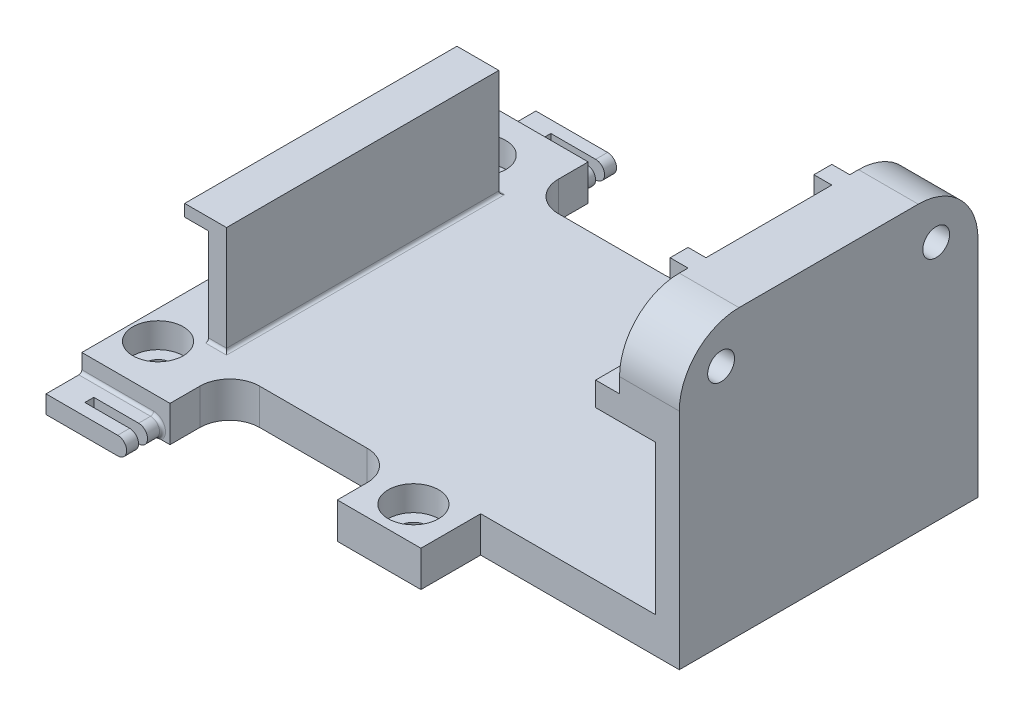
from build123d import *

# Parameters (mm, degrees)
EXTRUDE_BASE_DEPTH              = 35
SKETCH2_R                       = 2.2
SKETCH2_R_2                     = 2.2479
CUT_BOLT_HOLES_DEPTH            = 10
CUT_BOLT_HEAD_INSETS_DEPTH      = 13
CUT_BOLT_HEAD_INSETS_DEPTH_BACK = 4.2
SKETCH3_R                       = 4.215
SKETCH4_W                       = 40
SKETCH4_H                       = 3
CUT_TOP_CLEARANCE_SLOT_DEPTH    = 45
FILLET_CLEARANCE_SLOT_PT_1_R    = 3
FILLET_CLEARANCE_SLOT_PT_2_R    = 3
BOSS_EXTRUDE1_DEPTH             = 6
BOSS_EXTRUDE2_START             = 6
BOSS_EXTRUDE2_DEPTH             = 6
SKETCH9_R                       = 2.2479
BOSS_EXTRUDE3_DEPTH             = 10
FILLET1_R                       = 0.5
CUT_EXTRUDE1_REACH              = 103.769
SKETCH10_W                      = 7
SKETCH10_H                      = 12.215570114
FILLET2_R                       = 0.5
CUT_EXTRUDE2_START              = -35
SKETCH11_W                      = 33.244666378
SKETCH11_H                      = 11
CUT_EXTRUDE2_DEPTH              = 35
SKETCH13_W                      = 28
SKETCH13_H                      = 10.000570114
CUT_EXTRUDE5_DEPTH              = 6
FILLET3_R                       = 5
SKETCH14_W                      = 3
SKETCH14_H                      = 12.5
BOSS_EXTRUDE4_DEPTH             = 3
SKETCH15_W                      = 9
SKETCH15_H                      = 1.5
CUT_EXTRUDE6_DEPTH              = 10
CUT_EXTRUDE7_DEPTH              = 6


# Some blends are built 0.0001 mm under size
with BuildPart() as part:
    # Sketch1 → Extrude-Base (new, symmetric)
    with BuildSketch(Plane.XY):
        Polygon((-14, 0), (0, 0), (0, -35), (-90, -35), (-90, -29), (-81, -29), (-81, -13), (-85, -13), (-85, -11), (-78, -11), (-78, -29), (-4, -29), (-4, -4), (-14, -4), align=None)
    extrude(amount=EXTRUDE_BASE_DEPTH, both=True)

    # Sketch2 → Cut-Bolt Holes (cut)
    with BuildSketch(Plane(origin=(0, -29, 0), x_dir=(1, 0, 0), z_dir=(0, 1, 0))):
        with Locations(Location((-12, -10, 0), (0, 0, 270))):
            Circle(SKETCH2_R)
        with Locations(Location((-12, 10, 0), (0, 0, 180))):
            Circle(SKETCH2_R)
        with Locations(Location((-40.244666378, 29.250570114, 0), (0, 0, 270))):
            Circle(SKETCH2_R_2)
        with Locations(Location((-40.244666378, -29.249429886, 0), (0, 0, 270))):
            Circle(SKETCH2_R_2)
        with Locations(Location((-85.244666378, 27.000570114, 0), (0, 0, 270))):
            Circle(SKETCH2_R)
        with Locations(Location((-85.244666378, -26.999429886, 0), (0, 0, 270))):
            Circle(SKETCH2_R)
    extrude(amount=-CUT_BOLT_HOLES_DEPTH, mode=Mode.SUBTRACT)

    # Sketch3 → Cut-Bolt Head Insets (cut, two sides: drawn at the far end of the back side and taken through both)
    with BuildSketch(Plane(origin=(0, -29, 0), x_dir=(1, 0, 0), z_dir=(0, 1, 0)).offset(-CUT_BOLT_HEAD_INSETS_DEPTH_BACK)):
        with Locations((-12, -10)):
            Circle(SKETCH3_R)
        with Locations((-40.244666378, -29.249429886)):
            Circle(SKETCH3_R)
        with Locations((-85.244666378, -26.999429886)):
            Circle(SKETCH3_R)
        with Locations((-85.244666378, 27.000570114)):
            Circle(SKETCH3_R)
        with Locations(Location((-12, 10, 0), (0, 0, 90))):
            Circle(SKETCH3_R)
        with Locations(Location((-40.244666378, 29.249429886, 0), (0, 0, 90))):
            Circle(SKETCH3_R)
    extrude(amount=CUT_BOLT_HEAD_INSETS_DEPTH + CUT_BOLT_HEAD_INSETS_DEPTH_BACK, mode=Mode.SUBTRACT)

    # Sketch4 → Cut-Top Clearance Slot (cut)
    with BuildSketch(Plane.ZY.offset(90)):
        with Locations((0, -33.5)):
            Rectangle(SKETCH4_W, SKETCH4_H)
    extrude(amount=-CUT_TOP_CLEARANCE_SLOT_DEPTH, mode=Mode.SUBTRACT)

    # Fillet-Clearance Slot Pt 1
    fillet_clearance_slot_pt_1_edges = [part.edges().sort_by_distance(p)[0] for p in [
        (-67.5, -32, 20),
        (-67.5, -32, -20),
    ]]
    fillet(fillet_clearance_slot_pt_1_edges, radius=FILLET_CLEARANCE_SLOT_PT_1_R - 0.0001)  # a hair under: the kernel refuses the full size

    # Fillet-Clearance Slot Pt 2
    # the kernel refuses this fillet: 3 mm, written as the material it takes off along each edge
    with BuildSketch(Plane(origin=(-95.490486718, -35, 20), x_dir=(0, 0, 1), z_dir=(1, 0, 0))) as fillet_clearance_slot_pt_2_piece_1:
        with BuildLine():
            CenterArc((2.196194687, -3), FILLET_CLEARANCE_SLOT_PT_2_R, 90, 60.000551337)
            Line((-0.401895958, -1.500025), (-0.661705022, -1.3500275))
            ThreePointArc((-0.661705022, -1.3500275), (-0.3, -0.0001), (-0.3, 0))
            Line((-0.3, 0), (0, 0.3))
            Line((0, 0.3), (2.196194687, 0.3))
            Line((2.196194687, 0.3), (2.196194687, 0))
        make_face()
    extrude(amount=50.490486718, mode=Mode.SUBTRACT)
    with BuildSketch(Plane(origin=(-95.490486718, -35, -20), x_dir=(0, 0.9659313848535164, 0.2587982993664522), z_dir=(1, 0, 0))) as fillet_clearance_slot_pt_2_piece_2:
        with BuildLine():
            CenterArc((2.329422704, -2.897768274), FILLET_CLEARANCE_SLOT_PT_2_R, 105.000679234, 60.000551337)
            Line((-0.56837145, -2.121373376), (-0.858150866, -2.043733886))
            Line((-0.858150866, -2.043733886), (-0.289779415, 0.07763949))
            Line((-0.289779415, 0.07763949), (0.07763949, 0.289779415))
            ThreePointArc((0.07763949, 0.289779415), (0.077736083, 0.289753536), (1.475282068, 0.289776827))
            Line((1.475282068, 0.289776827), (1.552931216, 0))
        make_face()
    extrude(amount=50.490486718, mode=Mode.SUBTRACT)

    # Sketch5 → Boss-Extrude1 (add)
    with BuildSketch(Plane.XY.offset(35)):
        with BuildLine():
            Line((-78, -35), (-90, -35))
            Line((-90, -35), (-90, -32))
            Line((-90, -32), (-78, -32))
            ThreePointArc((-78, -32), (-76.5, -33.5), (-78, -35))
        make_face()
    extrude(amount=BOSS_EXTRUDE1_DEPTH)

    # Sketch7 → Boss-Extrude2 (add)
    with BuildSketch(Plane(origin=(0, 0, -35), x_dir=(-1, 0, 0), z_dir=(0, 0, -1)).offset(BOSS_EXTRUDE2_START)):
        with BuildLine():
            Line((78, -32), (90, -32))
            Line((90, -32), (90, -35))
            Line((90, -35), (78, -35))
            ThreePointArc((78, -35), (76.5, -33.5), (78, -32))
        make_face()
    extrude(amount=-BOSS_EXTRUDE2_DEPTH)

    # Sketch9 → Boss-Extrude3 (add)
    with BuildSketch(Plane(origin=(0, 0, 0), x_dir=(0, 0, -1), z_dir=(1, 0, 0))):
        with BuildLine():
            Line((25.000570114, 0), (-24.999429886, 0))
            Line((-24.999429886, 0), (-24.999429886, 2.5))
            ThreePointArc((-24.999429886, 2.5), (-22.070497698, 9.571067812), (-14.999429886, 12.5))
            Line((-14.999429886, 12.5), (15.000570114, 12.5))
            ThreePointArc((15.000570114, 12.5), (22.071637926, 9.571067812), (25.000570114, 2.5))
            Line((25.000570114, 2.5), (25.000570114, 0))
        make_face()
        with Locations(Location((-17.999429886, 5.5, 0), (0, 0, 90))):
            Circle(SKETCH9_R, mode=Mode.SUBTRACT)
        with Locations(Location((18.000570114, 5.5, 0), (0, 0, 90))):
            Circle(SKETCH9_R, mode=Mode.SUBTRACT)
    extrude(amount=-BOSS_EXTRUDE3_DEPTH)

    # Fillet1
    # the kernel refuses this fillet: 0.5 mm, written as the material it adds along each edge
    with BuildSketch(Plane(origin=(-78, -33.5, 35), x_dir=(0, 1, 0), z_dir=(-1, 0, 0))) as fillet1_piece_1_section:
        with BuildLine():
            CenterArc((1.5 + FILLET1_R, -FILLET1_R), FILLET1_R, 90, 90)
            Line((1.5, -FILLET1_R), (1.5, 0))
            Line((1.5, 0), (1.5 + FILLET1_R, 0))
        make_face()
    fillet1_piece_1 = revolve(axis=Axis((-78, -33.5, 35), (0, 0, -1)), revolution_arc=227.8232683, mode=Mode.PRIVATE)
    fillet1_piece_1 = split(fillet1_piece_1, bisect_by=Plane(origin=(-77.658393022, -35, 35.082006822), z_dir=(0, 1, 0)), keep=Keep.TOP, mode=Mode.PRIVATE)
    add(fillet1_piece_1)
    with BuildSketch(Plane(origin=(-90, -32, 35), x_dir=(0, 1, 0), z_dir=(1, 0, 0))) as fillet1_piece_2:
        with BuildLine():
            CenterArc((FILLET1_R, FILLET1_R), FILLET1_R, 180, 90)
            Line((0, FILLET1_R), (0, 0))
            Line((0, 0), (FILLET1_R, 0))
        make_face()
    extrude(amount=12)
    with BuildSketch(Plane(origin=(-78, -33.5, -35), x_dir=(-0.741077326598375, -0.6714196869334451, 0), z_dir=(-0.6714196869334451, 0.741077326598375, 0))) as fillet1_piece_3_section:
        with BuildLine():
            CenterArc((1.5 + FILLET1_R, -FILLET1_R), FILLET1_R, 90, 90)
            Line((1.5, -FILLET1_R), (1.5, 0))
            Line((1.5, 0), (1.5 + FILLET1_R, 0))
        make_face()
    fillet1_piece_3 = revolve(axis=Axis((-78, -33.5, -35), (0, 0, 1)), revolution_arc=227.8232683, mode=Mode.PRIVATE)
    fillet1_piece_3 = split(fillet1_piece_3, bisect_by=Plane(origin=(-76.494034021, -35, -35.2500003), z_dir=(0, 1, 0)), keep=Keep.TOP, mode=Mode.PRIVATE)
    add(fillet1_piece_3)
    with BuildSketch(Plane(origin=(-78, -32, -35), x_dir=(0, 0, -1), z_dir=(-1, 0, 0))) as fillet1_piece_4:
        with BuildLine():
            CenterArc((FILLET1_R, -FILLET1_R), FILLET1_R, 90, 90)
            Line((0, -FILLET1_R), (0, 0))
            Line((0, 0), (FILLET1_R, 0))
        make_face()
    extrude(amount=12)

    # Cut-Extrude1: up to this face of the body (flat: up to its plane)
    cut_extrude1_end = Plane(part.part.faces().sort_by_distance((-85.554984705, -29, 0.000122771))[0])
    # Sketch10 → Cut-Extrude1 (cut, up to the picked face)
    with BuildSketch(Plane(origin=(0, -11, 0), x_dir=(1, 0, 0), z_dir=(0, 1, 0)), mode=Mode.PRIVATE) as cut_extrude1_sk1:
        with Locations((-81.5, -28.892214943)):
            Rectangle(SKETCH10_W, SKETCH10_H)
    cut_extrude1_tool1 = split(extrude(cut_extrude1_sk1.sketch, amount=-CUT_EXTRUDE1_REACH, mode=Mode.PRIVATE), bisect_by=cut_extrude1_end, keep=Keep.BOTH, mode=Mode.PRIVATE)
    # Sketch10 → Cut-Extrude1 (cut, up to the picked face)
    with BuildSketch(Plane(origin=(0, -11, 0), x_dir=(1, 0, 0), z_dir=(0, 1, 0)), mode=Mode.PRIVATE) as cut_extrude1_sk2:
        Polygon((-85, 22.785570416), (-78, 22.784429886), (-78, 35), (-85, 35), align=None)
    cut_extrude1_tool2 = split(extrude(cut_extrude1_sk2.sketch, amount=-CUT_EXTRUDE1_REACH, mode=Mode.PRIVATE), bisect_by=cut_extrude1_end, keep=Keep.BOTH, mode=Mode.PRIVATE)
    add(cut_extrude1_tool1.solids().sort_by(Axis((-81.5, -11, 28.892215), (0, -1, 0)))[0], mode=Mode.SUBTRACT)
    add(cut_extrude1_tool2.solids().sort_by(Axis((-81.499946, -11, -28.8925), (0, -1, 0)))[0], mode=Mode.SUBTRACT)

    # Fillet2
    fillet2_edges = [part.edges().sort_by_distance(p)[0] for p in [
        (-78, -29, 0),
        (-79.5, -29, 22.784429886),
        (-79.5, -29, -22.784674285),
    ]]
    fillet(fillet2_edges, radius=FILLET2_R)

    # Sketch11 → Cut-Extrude2 (cut)
    with BuildSketch(Plane(origin=(0, 0, 0), x_dir=(1, 0, 0), z_dir=(0, 1, 0)).offset(CUT_EXTRUDE2_START)):
        with Locations((-16.622333189, -30.499429886)):
            Rectangle(SKETCH11_W, SKETCH11_H)
        with Locations((-16.622333189, 30.499429886)):
            Rectangle(SKETCH11_W, SKETCH11_H)
    extrude(amount=CUT_EXTRUDE2_DEPTH, mode=Mode.SUBTRACT)

    # Sketch13 → Cut-Extrude5 (cut)
    with BuildSketch(Plane(origin=(0, -29, 0), x_dir=(1, 0, 0), z_dir=(0, 1, 0))):
        with Locations((-61.244666378, -29.999714943)):
            Rectangle(SKETCH13_W, SKETCH13_H)
        with Locations((-61.244666378, 29.999714943)):
            Rectangle(SKETCH13_W, SKETCH13_H)
    extrude(amount=-CUT_EXTRUDE5_DEPTH, mode=Mode.SUBTRACT)

    # Fillet3
    fillet3_edges = [part.edges().sort_by_distance(p)[0] for p in [
        (-75.244666378, -32, 24.999429886),
        (-47.244666378, -32, 24.999429886),
        (-75.244666378, -32, -24.999429886),
        (-47.244666378, -32, -24.999429886),
    ]]
    fillet(fillet3_edges, radius=FILLET3_R)

    # Sketch14 → Boss-Extrude4 (add)
    with BuildSketch(Plane.ZY.offset(10)):
        with Locations((12.033169886, 6.25)):
            Rectangle(SKETCH14_W, SKETCH14_H)
        with Locations((-12.033169886, 6.25)):
            Rectangle(SKETCH14_W, SKETCH14_H)
    extrude(amount=BOSS_EXTRUDE4_DEPTH)

    # Sketch15 → Cut-Extrude6 (cut)
    with BuildSketch(Plane(origin=(0, -32, 0), x_dir=(1, 0, 0), z_dir=(0, 1, 0))):
        with Locations((-81, -38.25)):
            Rectangle(SKETCH15_W, SKETCH15_H)
    cut_extrude6 = extrude(amount=-CUT_EXTRUDE6_DEPTH, mode=Mode.SUBTRACT)

    # Mirror1: Cut-Extrude6 across plane
    add(cut_extrude6.mirror(Plane.XY), mode=Mode.SUBTRACT)

    # Sketch16 → Cut-Extrude7 (cut)
    with BuildSketch(Plane.ZY.offset(10)):
        Polygon((-18.000570114, 0.4), (-13.583840555, 2.95), (-13.583840555, 8.05), (-18.000570114, 10.6), (-22.417299673, 8.05), (-22.417299673, 2.95), align=None)
        Polygon((22.417299673, 2.95), (18.000570114, 0.4), (13.583840555, 2.95), (13.583840555, 8.05), (18.000570114, 10.6), (22.417299673, 8.05), align=None)
    extrude(amount=-CUT_EXTRUDE7_DEPTH, mode=Mode.SUBTRACT)


solid = part.part
